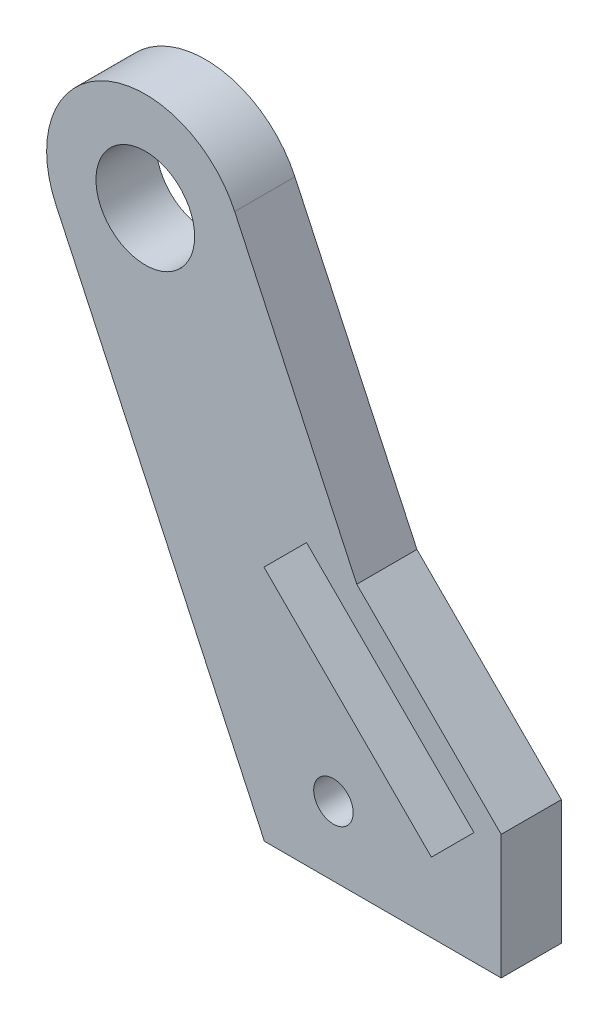
from build123d import *

# Parameters (mm, degrees)
SKETCH1_R           = 1
SKETCH1_R_2         = 2.5
BOSS_EXTRUDE1_DEPTH = 3.05


with BuildPart() as part:
    # Sketch1 → Boss-Extrude1 (new body)
    with BuildSketch(Plane.XY):
        with BuildLine():
            Line((12, 0), (12, 6.303908615))
            Line((12, 6.303908615), (4.681585686, 13.62232293))
            Line((4.681585686, 13.62232293), (-1.502378673, 26.883877293))
            ThreePointArc((-1.502378673, 26.883877293), (-8.147008917, 29.30232492), (-10.565456544, 22.657694676))
            Line((-10.565456544, 22.657694676), (0, 0))
            Line((0, 0), (12, 0))
        make_face()
        Polygon((8.464466094, 3.535533906), (-0.02081528, 12.02081528), (2.135860402, 14.177490963), (10.621141777, 5.692209589), align=None, mode=Mode.SUBTRACT)
        with Locations((3.5, 3.5)):
            Circle(SKETCH1_R, mode=Mode.SUBTRACT)
        with Locations((-6.033917608, 24.770785985)):
            Circle(SKETCH1_R_2, mode=Mode.SUBTRACT)
    extrude(amount=BOSS_EXTRUDE1_DEPTH)


solid = part.part
